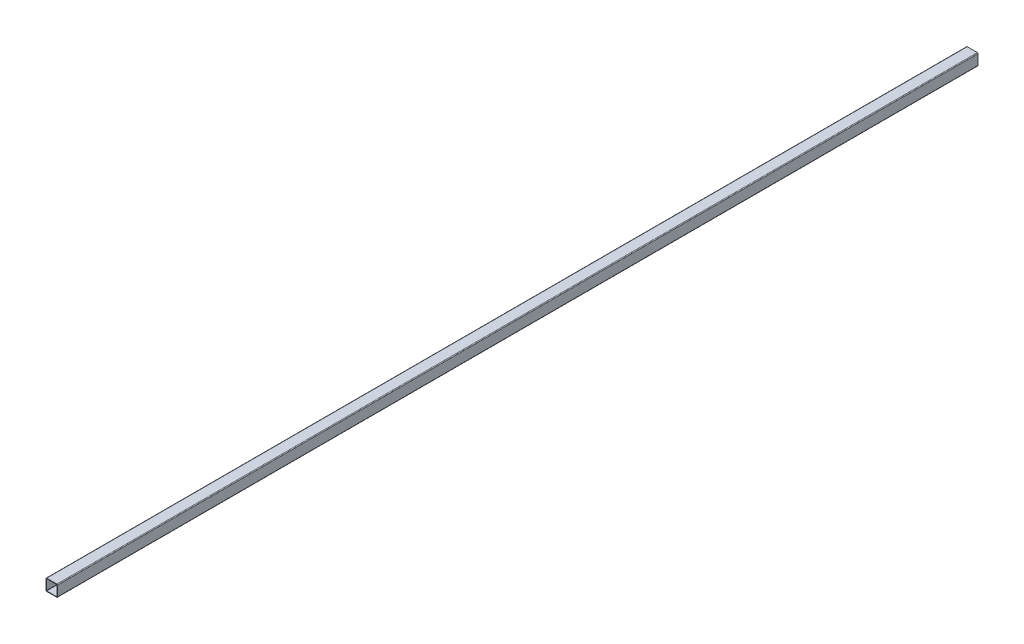
from build123d import *

# Parameters (mm, degrees)
BOSS_EXTRUDE1_DEPTH = 3048


with BuildPart() as part:
    # inch square tube → Boss-Extrude1 (new body)
    with BuildSketch(Plane.XY):
        with BuildLine():
            Line((16.65, -19.05), (-16.65, -19.05))
            ThreePointArc((-16.65, -19.05), (-18.347056275, -18.347056275), (-19.05, -16.65))
            Line((-19.05, -16.65), (-19.05, 16.65))
            ThreePointArc((-19.05, 16.65), (-18.347056275, 18.347056275), (-16.65, 19.05))
            Line((-16.65, 19.05), (16.65, 19.05))
            ThreePointArc((16.65, 19.05), (18.347056275, 18.347056275), (19.05, 16.65))
            Line((19.05, 16.65), (19.05, -16.65))
            ThreePointArc((19.05, -16.65), (18.347056275, -18.347056275), (16.65, -19.05))
        make_face()
        with BuildLine():
            Line((-16.65, 17.45), (16.65, 17.45))
            ThreePointArc((16.65, 17.45), (17.215685425, 17.215685425), (17.45, 16.65))
            Line((17.45, 16.65), (17.45, -16.65))
            ThreePointArc((17.45, -16.65), (17.215685425, -17.215685425), (16.65, -17.45))
            Line((16.65, -17.45), (-16.65, -17.45))
            ThreePointArc((-16.65, -17.45), (-17.215685425, -17.215685425), (-17.45, -16.65))
            Line((-17.45, -16.65), (-17.45, 16.65))
            ThreePointArc((-17.45, 16.65), (-17.215685425, 17.215685425), (-16.65, 17.45))
        make_face(mode=Mode.SUBTRACT)
    extrude(amount=BOSS_EXTRUDE1_DEPTH)


solid = part.part
